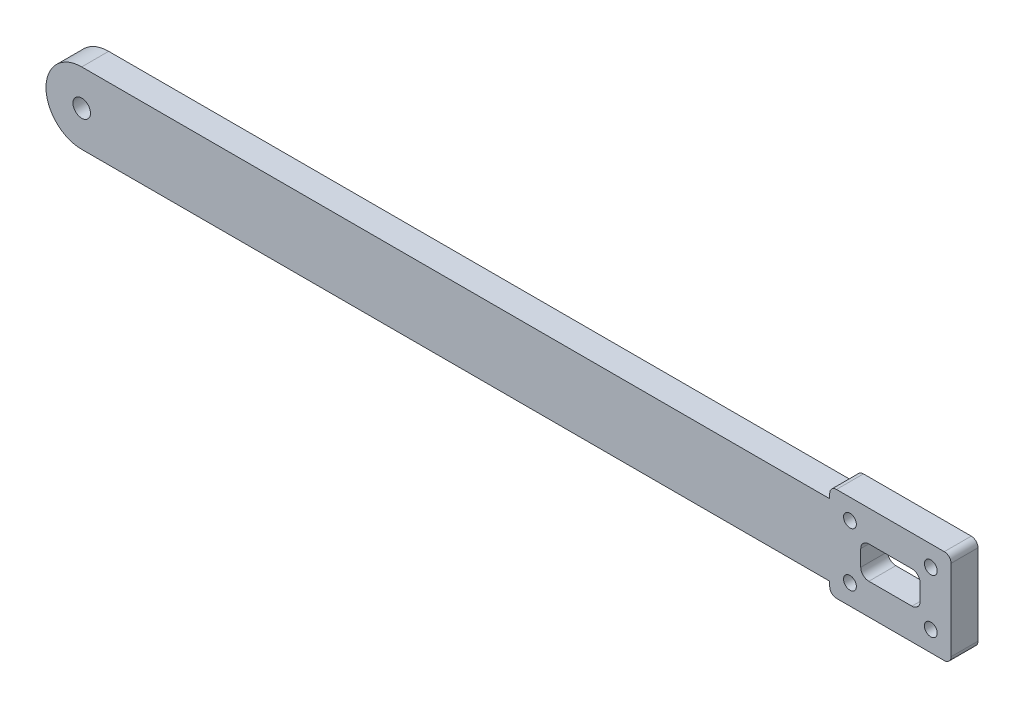
from build123d import *

# Parameters (mm, degrees)
SKETCH1_R      = 3.25
SKETCH1_R_2    = 2.375
MAIN_ARM_DEPTH = 10
FILLET1_R      = 2.5


with BuildPart() as part:
    # Sketch1 → Main Arm (new body)
    with BuildSketch(Plane.XY):
        with BuildLine():
            ThreePointArc((0, 13.25), (-13.25, 0), (0, -13.25))
            Line((0, -13.25), (277.5, -13.25))
            Line((277.5, -13.25), (277.5, -17.5))
            Line((277.5, -17.5), (322.5, -17.5))
            Line((322.5, -17.5), (322.5, 17.5))
            Line((322.5, 17.5), (277.5, 17.5))
            Line((277.5, 17.5), (277.5, 13.25))
            Line((277.5, 13.25), (0, 13.25))
        make_face()
        Circle(SKETCH1_R, mode=Mode.SUBTRACT)
        with Locations((285, 10)):
            Circle(SKETCH1_R_2, mode=Mode.SUBTRACT)
        with Locations((285, -10)):
            Circle(SKETCH1_R_2, mode=Mode.SUBTRACT)
        with BuildLine():
            Line((308, -6), (292, -6))
            ThreePointArc((292, -6), (289.878679656, -5.121320344), (289, -3))
            Line((289, -3), (289, 3))
            ThreePointArc((289, 3), (289.878679656, 5.121320344), (292, 6))
            Line((292, 6), (308, 6))
            ThreePointArc((308, 6), (310.121320344, 5.121320344), (311, 3))
            Line((311, 3), (311, -3))
            ThreePointArc((311, -3), (310.121320344, -5.121320344), (308, -6))
        make_face(mode=Mode.SUBTRACT)
        with Locations((315, 10)):
            Circle(SKETCH1_R_2, mode=Mode.SUBTRACT)
        with Locations((315, -10)):
            Circle(SKETCH1_R_2, mode=Mode.SUBTRACT)
    extrude(amount=MAIN_ARM_DEPTH)

    # Fillet1
    fillet1_edges = [part.edges().sort_by_distance(p)[0] for p in [
        (277.5, -17.5, 5),
        (322.5, -17.5, 5),
        (322.5, 17.5, 5),
        (277.5, 17.5, 5),
    ]]
    fillet(fillet1_edges, radius=FILLET1_R)


solid = part.part
